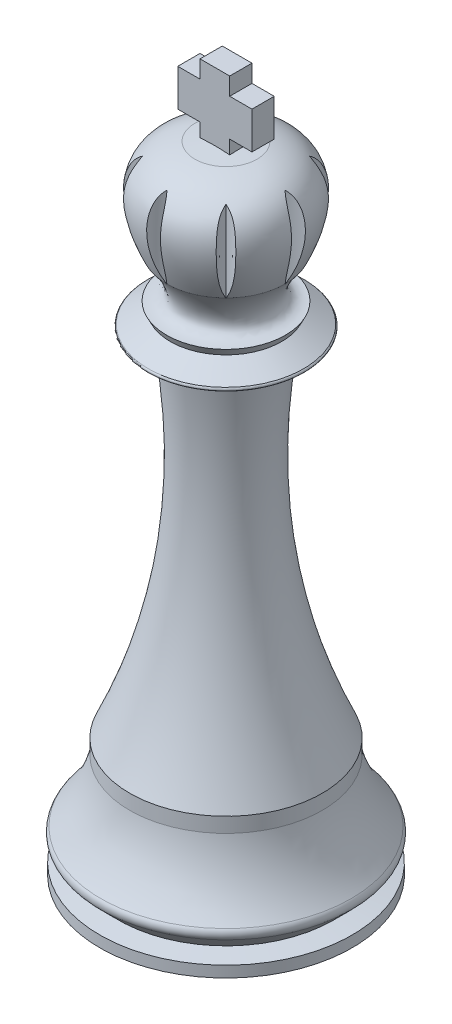
from build123d import *

# Parameters (mm, degrees)
FILLET1_R           = 1
FILLET2_R           = 0.25
BOSS_EXTRUDE1_DEPTH = 1.5
CUT_EXTRUDE1_REACH  = 100.036
CIRPATTERN1_COUNT   = 8


with BuildPart() as part:
    # Sketch2 → Revolve1 (revolve)
    with BuildSketch(Plane.XY):
        with BuildLine():
            Line((0, 0), (17, 0))
            Line((17, 0), (17, 1.5))
            Line((17, 1.5), (14.449688693, 1.949688693))
            Line((14.449688693, 1.949688693), (17.5, 5))
            add(Edge.make_bspline(
                [(12.976411859, 14.03), (13.902117659, 8.737562454), (17.5, 5)],
                knots=[0, 0, 0, 1, 1, 1], degree=2))
            Line((12.976411859, 14.03), (12.976411859, 16.03))
            add(Edge.make_bspline(
                [(7, 63), (3.049044893, 38.107380974), (12.976411859, 16.03)],
                knots=[0, 0, 0, 1, 1, 1], degree=2))
            Line((7, 63), (11, 64))
            Line((11, 64), (7.5, 66))
            Line((7.5, 66), (8, 67))
            add(Edge.make_bspline(
                [(8, 67), (3.868005212, 67.03145387), (6.670598498, 71.419208712), (8, 73)],
                knots=[0, 0, 0, 0, 1, 1, 1, 1], degree=3))
            add(Edge.make_bspline(
                [(4.188567246, 85.63354785), (12.998071442, 83.622348143), (8, 73)],
                knots=[0, 0, 0, 1, 1, 1], degree=2))
            Line((4.188567246, 85.63354785), (0, 86))
            Line((0, 86), (0, 0))
        make_face()
    revolve(axis=Axis((0, 95, 0), (0, -1, 0)))

    # Fillet1
    fillet1_edges = [part.edges().sort_by_distance(p)[0] for p in [
        (-17.5, 5, 0),
    ]]
    fillet(fillet1_edges, radius=FILLET1_R)

    # Fillet2
    fillet2_edges = [part.edges().sort_by_distance(p)[0] for p in [
        (-11, 64, 0),
    ]]
    fillet(fillet2_edges, radius=FILLET2_R)

    # Sketch3 → Boss-Extrude1 (add, symmetric)
    with BuildSketch(Plane.XY):
        Polygon((-2, 95), (2, 95), (2, 92.63354785), (5, 92.63354785), (5, 87.63354785), (2, 87.63354785), (2, 85.63354785), (-2, 85.63354785), (-2, 87.63354785), (-5, 87.63354785), (-5, 92.63354785), (-2, 92.63354785), align=None)
    extrude(amount=BOSS_EXTRUDE1_DEPTH, both=True)

    # Cut-Extrude1: up to this cone (the profile starts outside it)
    cut_extrude1_end = Plane(origin=(0, 95, 0), z_dir=(0, -1, 0)).offset(24.714286714) * Cone(1.75e-06, 132.688, 75.821713286, align=(Align.CENTER, Align.CENTER, Align.MIN), mode=Mode.PRIVATE)
    # Sketch4 → Cut-Extrude1 (cut, up to the surface)
    with BuildSketch(Plane(origin=(0, 95, 0), x_dir=(1, 0, 0), z_dir=(0, 1, 0)), mode=Mode.PRIVATE) as cut_extrude1_sk1:
        with BuildLine():
            Line((-1, 10.538413349), (1, 10.538413349))
            add(Edge.make_bspline(
                [(1, 10.538413349), (1.023296472, 9.096719696), (0, 7.954905764)],
                knots=[0, 0, 0, 1, 1, 1], degree=2))
            add(Edge.make_bspline(
                [(-1, 10.538413349), (-1.023296472, 9.096719696), (0, 7.954905764)],
                knots=[0, 0, 0, 1, 1, 1], degree=2))
        make_face()
    cut_extrude1_tool1 = extrude(cut_extrude1_sk1.sketch, amount=-CUT_EXTRUDE1_REACH, mode=Mode.PRIVATE) - cut_extrude1_end
    cut_extrude1 = cut_extrude1_tool1.solids().sort_by_distance((0, 95, -9.548602))[0]
    add(cut_extrude1, mode=Mode.SUBTRACT)

    # CirPattern1: Cut-Extrude1 ×8 about axis
    cirpattern1_axis = Axis((0, 5.686104528, 0), (0, 1, 0))
    for i in range(1, CIRPATTERN1_COUNT):
        add(cut_extrude1.rotate(cirpattern1_axis, i * 360 / CIRPATTERN1_COUNT), mode=Mode.SUBTRACT)


solid = part.part
